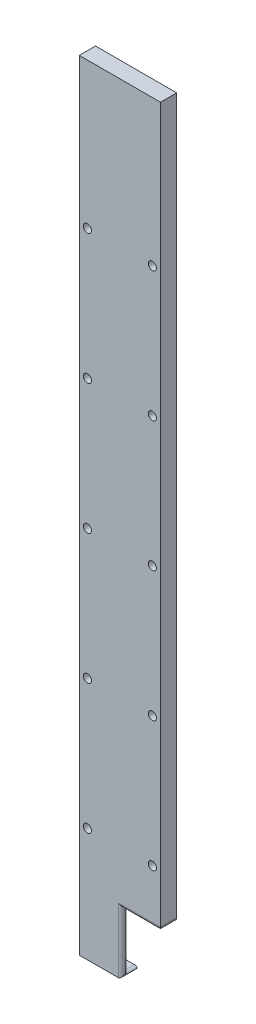
from build123d import *

# Parameters (mm, degrees)
SKETCH2_R           = 1.25
BOSS_EXTRUDE1_DEPTH = 5
CUT_EXTRUDE1_DEPTH  = 3
SKETCH4_W           = 12
SKETCH4_H           = 19
CUT_EXTRUDE2_DEPTH  = 10
FILLET1_R           = 1


with BuildPart() as part:
    # Sketch2 → Boss-Extrude1 (new body)
    with BuildSketch(Plane.XY):
        Polygon((120, 0), (120, -12.5), (145, -12.5), (145, 0), (145, 227.5), (120, 227.5), align=None)
        with Locations((142.5, 22.6)):
            Circle(SKETCH2_R, mode=Mode.SUBTRACT)
        with Locations((142.5, 62.6)):
            Circle(SKETCH2_R, mode=Mode.SUBTRACT)
        with Locations((142.5, 102.6)):
            Circle(SKETCH2_R, mode=Mode.SUBTRACT)
        with Locations((142.5, 142.6)):
            Circle(SKETCH2_R, mode=Mode.SUBTRACT)
        with Locations((142.5, 182.6)):
            Circle(SKETCH2_R, mode=Mode.SUBTRACT)
        with Locations((122.5, 182.6)):
            Circle(SKETCH2_R, mode=Mode.SUBTRACT)
        with Locations((122.5, 142.6)):
            Circle(SKETCH2_R, mode=Mode.SUBTRACT)
        with Locations((122.5, 62.6)):
            Circle(SKETCH2_R, mode=Mode.SUBTRACT)
        with Locations((122.5, 102.6)):
            Circle(SKETCH2_R, mode=Mode.SUBTRACT)
        with Locations((122.5, 22.6)):
            Circle(SKETCH2_R, mode=Mode.SUBTRACT)
    extrude(amount=BOSS_EXTRUDE1_DEPTH)

    # Sketch3 → Cut-Extrude1 (cut)
    with BuildSketch(Plane(origin=(0, 0, 0), x_dir=(-1, 0, 0), z_dir=(0, 0, -1))):
        Polygon((-125, 177.6), (-120, 177.6), (-120, 162.6), (-125, 162.6), (-125, 127.6), (-120, 127.6), (-120, 112.6), (-125, 112.6), (-125, 82.6), (-120, 82.6), (-120, 67.6), (-125, 67.6), (-125, 42.6), (-120, 42.6), (-120, 27.6), (-125, 27.6), (-125, 0), (-125, -11.5), (-145, -11.5), (-145, 6.5), (-140, 6.5), (-140, 205.2), (-125, 205.2), align=None)
    extrude(amount=-CUT_EXTRUDE1_DEPTH, mode=Mode.SUBTRACT)

    # Sketch4 → Cut-Extrude2 (cut)
    with BuildSketch(Plane(origin=(0, 0, 0), x_dir=(-1, 0, 0), z_dir=(0, 0, -1))):
        with Locations((-139, -3)):
            Rectangle(SKETCH4_W, SKETCH4_H)
    extrude(amount=-CUT_EXTRUDE2_DEPTH, mode=Mode.SUBTRACT)

    # Fillet1
    # the kernel refuses this fillet: 1 mm, written as the material it takes off along each edge
    with BuildSketch(Plane(origin=(133, 6.5, 3), x_dir=(0, 0, 1), z_dir=(0, -1, 0))) as fillet1_piece_1:
        with BuildLine():
            CenterArc((FILLET1_R, FILLET1_R), FILLET1_R, 180, 90)
            Line((0, FILLET1_R), (-FILLET1_R * 0.02, FILLET1_R))
            Line((-FILLET1_R * 0.02, FILLET1_R), (-FILLET1_R * 0.02, -FILLET1_R * 0.02))
            Line((-FILLET1_R * 0.02, -FILLET1_R * 0.02), (FILLET1_R, -FILLET1_R * 0.02))
            Line((FILLET1_R, -FILLET1_R * 0.02), (FILLET1_R, 0))
        make_face()
    extrude(amount=18, mode=Mode.SUBTRACT)
    with BuildSketch(Plane(origin=(133, 6.5, 5), x_dir=(0, 0, -1), z_dir=(0, -1, 0))) as fillet1_piece_2:
        with BuildLine():
            CenterArc((FILLET1_R, -FILLET1_R), FILLET1_R, 90, 90)
            Line((0, -FILLET1_R), (-FILLET1_R * 0.02, -FILLET1_R))
            Line((-FILLET1_R * 0.02, -FILLET1_R), (-FILLET1_R * 0.02, FILLET1_R * 0.02))
            Line((-FILLET1_R * 0.02, FILLET1_R * 0.02), (FILLET1_R, FILLET1_R * 0.02))
            Line((FILLET1_R, FILLET1_R * 0.02), (FILLET1_R, 0))
        make_face()
    extrude(amount=19, mode=Mode.SUBTRACT)
    with BuildSketch(Plane(origin=(133, -12.5, 0), x_dir=(0, 1, 0), z_dir=(0, 0, 1)), Plane(origin=(145, 6.5, 5), x_dir=(-1, 0, 0), z_dir=(0, 0, -1))) as fillet1_piece_3:
        with BuildLine():
            CenterArc((FILLET1_R, FILLET1_R), FILLET1_R, 180, 90)
            Line((0, FILLET1_R), (-FILLET1_R * 0.02, FILLET1_R))
            Line((-FILLET1_R * 0.02, FILLET1_R), (-FILLET1_R * 0.02, -FILLET1_R * 0.02))
            Line((-FILLET1_R * 0.02, -FILLET1_R * 0.02), (FILLET1_R, -FILLET1_R * 0.02))
            Line((FILLET1_R, -FILLET1_R * 0.02), (FILLET1_R, 0))
        make_face()
    extrude(amount=5, mode=Mode.SUBTRACT)
    with BuildSketch(Plane(origin=(133, -11.5, 0), x_dir=(0, -1, 0), z_dir=(0, 0, 1)), Plane(origin=(120, 42.6, 0), x_dir=(0, 1, 0), z_dir=(0, 0, 1)), Plane(origin=(120, 82.6, 0), x_dir=(0, 1, 0), z_dir=(0, 0, 1)), Plane(origin=(120, 127.6, 0), x_dir=(0, 1, 0), z_dir=(0, 0, 1)), Plane(origin=(120, 177.6, 0), x_dir=(0, 1, 0), z_dir=(0, 0, 1))) as fillet1_piece_4:
        with BuildLine():
            CenterArc((FILLET1_R, -FILLET1_R), FILLET1_R, 90, 90)
            Line((0, -FILLET1_R), (-FILLET1_R * 0.02, -FILLET1_R))
            Line((-FILLET1_R * 0.02, -FILLET1_R), (-FILLET1_R * 0.02, FILLET1_R * 0.02))
            Line((-FILLET1_R * 0.02, FILLET1_R * 0.02), (FILLET1_R, FILLET1_R * 0.02))
            Line((FILLET1_R, FILLET1_R * 0.02), (FILLET1_R, 0))
        make_face()
    extrude(amount=3, mode=Mode.SUBTRACT)
    with BuildSketch(Plane(origin=(140, 6.5, 0), x_dir=(1, 0, 0), z_dir=(0, 0, 1)), Plane(origin=(120, 27.6, 0), x_dir=(0, -1, 0), z_dir=(0, 0, 1)), Plane(origin=(120, 67.6, 0), x_dir=(0, -1, 0), z_dir=(0, 0, 1)), Plane(origin=(120, 112.6, 0), x_dir=(0, -1, 0), z_dir=(0, 0, 1)), Plane(origin=(120, 162.6, 0), x_dir=(0, -1, 0), z_dir=(0, 0, 1))) as fillet1_piece_5:
        with BuildLine():
            CenterArc((FILLET1_R, FILLET1_R), FILLET1_R, 180, 90)
            Line((0, FILLET1_R), (-FILLET1_R * 0.02, FILLET1_R))
            Line((-FILLET1_R * 0.02, FILLET1_R), (-FILLET1_R * 0.02, -FILLET1_R * 0.02))
            Line((-FILLET1_R * 0.02, -FILLET1_R * 0.02), (FILLET1_R, -FILLET1_R * 0.02))
            Line((FILLET1_R, -FILLET1_R * 0.02), (FILLET1_R, 0))
        make_face()
    extrude(amount=3, mode=Mode.SUBTRACT)
    with BuildSketch(Plane(origin=(140, 6.5, 3), x_dir=(0, 0, 1), z_dir=(-1, 0, 0))) as fillet1_piece_6:
        with BuildLine():
            CenterArc((FILLET1_R, FILLET1_R), FILLET1_R, 180, 90)
            Line((0, FILLET1_R), (-FILLET1_R * 0.02, FILLET1_R))
            Line((-FILLET1_R * 0.02, FILLET1_R), (-FILLET1_R * 0.02, -FILLET1_R * 0.02))
            Line((-FILLET1_R * 0.02, -FILLET1_R * 0.02), (FILLET1_R, -FILLET1_R * 0.02))
            Line((FILLET1_R, -FILLET1_R * 0.02), (FILLET1_R, 0))
        make_face()
    extrude(amount=7, mode=Mode.SUBTRACT)
    with BuildSketch(Plane(origin=(145, 6.5, 5), x_dir=(0, 0, -1), z_dir=(-1, 0, 0))) as fillet1_piece_7:
        with BuildLine():
            CenterArc((FILLET1_R, -FILLET1_R), FILLET1_R, 90, 90)
            Line((0, -FILLET1_R), (-FILLET1_R * 0.02, -FILLET1_R))
            Line((-FILLET1_R * 0.02, -FILLET1_R), (-FILLET1_R * 0.02, FILLET1_R * 0.02))
            Line((-FILLET1_R * 0.02, FILLET1_R * 0.02), (FILLET1_R, FILLET1_R * 0.02))
            Line((FILLET1_R, FILLET1_R * 0.02), (FILLET1_R, 0))
        make_face()
    extrude(amount=12, mode=Mode.SUBTRACT)
    with BuildSketch(Plane(origin=(120, 42.6, 3), x_dir=(0, 0, 1), z_dir=(0, -1, 0)), Plane(origin=(120, 82.6, 3), x_dir=(0, 0, 1), z_dir=(0, -1, 0)), Plane(origin=(120, 127.6, 3), x_dir=(0, 0, 1), z_dir=(0, -1, 0)), Plane(origin=(120, 177.6, 3), x_dir=(0, 0, 1), z_dir=(0, -1, 0))) as fillet1_piece_8:
        with BuildLine():
            CenterArc((FILLET1_R, -FILLET1_R), FILLET1_R, 90, 90)
            Line((0, -FILLET1_R), (-FILLET1_R * 0.02, -FILLET1_R))
            Line((-FILLET1_R * 0.02, -FILLET1_R), (-FILLET1_R * 0.02, FILLET1_R * 0.02))
            Line((-FILLET1_R * 0.02, FILLET1_R * 0.02), (FILLET1_R, FILLET1_R * 0.02))
            Line((FILLET1_R, FILLET1_R * 0.02), (FILLET1_R, 0))
        make_face()
    extrude(amount=15, mode=Mode.SUBTRACT)
    with BuildSketch(Plane(origin=(133, 9, 3), x_dir=(0, 0, 1), z_dir=(0, -1, 0))) as fillet1_piece_9a_section:
        with BuildLine():
            CenterArc((FILLET1_R, FILLET1_R), FILLET1_R, 180, 90)
            Line((0, FILLET1_R), (-FILLET1_R * 0.02, FILLET1_R))
            Line((-FILLET1_R * 0.02, FILLET1_R), (-FILLET1_R * 0.02, -FILLET1_R * 0.02))
            Line((-FILLET1_R * 0.02, -FILLET1_R * 0.02), (FILLET1_R, -FILLET1_R * 0.02))
            Line((FILLET1_R, -FILLET1_R * 0.02), (FILLET1_R, 0))
        make_face()
    fillet1_piece_9a = extrude(amount=20.5, mode=Mode.PRIVATE)
    fillet1_piece_9a = split(fillet1_piece_9a, bisect_by=Plane(origin=(132.773604886, 6.5, 3.226395114), z_dir=(0, 1, 0)), keep=Keep.TOP, mode=Mode.PRIVATE)
    with BuildSketch(Plane(origin=(140, 6.5, 3), x_dir=(0, 0, 1), z_dir=(-1, 0, 0))) as fillet1_piece_9b_section:
        with BuildLine():
            CenterArc((FILLET1_R, FILLET1_R), FILLET1_R, 180, 90)
            Line((0, FILLET1_R), (-FILLET1_R * 0.02, FILLET1_R))
            Line((-FILLET1_R * 0.02, FILLET1_R), (-FILLET1_R * 0.02, -FILLET1_R * 0.02))
            Line((-FILLET1_R * 0.02, -FILLET1_R * 0.02), (FILLET1_R, -FILLET1_R * 0.02))
            Line((FILLET1_R, -FILLET1_R * 0.02), (FILLET1_R, 0))
        make_face()
    fillet1_piece_9b = extrude(amount=9.5, mode=Mode.PRIVATE)
    fillet1_piece_9b = split(fillet1_piece_9b, bisect_by=Plane(origin=(133, 6.726395114, 3.226395114), z_dir=(-1, 0, 0)), keep=Keep.TOP, mode=Mode.PRIVATE)
    fillet1_piece_9 = fillet1_piece_9a & fillet1_piece_9b
    add(fillet1_piece_9, mode=Mode.SUBTRACT)
    with BuildSketch(Plane(origin=(133, -11.5, 0), x_dir=(0, -1, 0), z_dir=(0, 0, 1))) as fillet1_piece_10a_section:
        with BuildLine():
            CenterArc((FILLET1_R, -FILLET1_R), FILLET1_R, 90, 90)
            Line((0, -FILLET1_R), (-FILLET1_R * 0.02, -FILLET1_R))
            Line((-FILLET1_R * 0.02, -FILLET1_R), (-FILLET1_R * 0.02, FILLET1_R * 0.02))
            Line((-FILLET1_R * 0.02, FILLET1_R * 0.02), (FILLET1_R, FILLET1_R * 0.02))
            Line((FILLET1_R, FILLET1_R * 0.02), (FILLET1_R, 0))
        make_face()
    fillet1_piece_10a = extrude(amount=5.5, mode=Mode.PRIVATE)
    fillet1_piece_10a = split(fillet1_piece_10a, bisect_by=Plane(origin=(132.773604886, -11.726395114, 3), z_dir=(0, 0, 1)), keep=Keep.TOP, mode=Mode.PRIVATE)
    with BuildSketch(Plane(origin=(133, 6.5, 3), x_dir=(0, 0, 1), z_dir=(0, -1, 0))) as fillet1_piece_10b_section:
        with BuildLine():
            CenterArc((FILLET1_R, FILLET1_R), FILLET1_R, 180, 90)
            Line((0, FILLET1_R), (-FILLET1_R * 0.02, FILLET1_R))
            Line((-FILLET1_R * 0.02, FILLET1_R), (-FILLET1_R * 0.02, -FILLET1_R * 0.02))
            Line((-FILLET1_R * 0.02, -FILLET1_R * 0.02), (FILLET1_R, -FILLET1_R * 0.02))
            Line((FILLET1_R, -FILLET1_R * 0.02), (FILLET1_R, 0))
        make_face()
    fillet1_piece_10b = extrude(amount=20.5, mode=Mode.PRIVATE)
    fillet1_piece_10b = split(fillet1_piece_10b, bisect_by=Plane(origin=(132.773604886, -11.5, 3.226395114), z_dir=(0, -1, 0)), keep=Keep.TOP, mode=Mode.PRIVATE)
    fillet1_piece_10 = fillet1_piece_10a & fillet1_piece_10b
    add(fillet1_piece_10, mode=Mode.SUBTRACT)
    with BuildSketch(Plane(origin=(133, 9, 5), x_dir=(0, 0, -1), z_dir=(0, -1, 0))) as fillet1_piece_11a_section:
        with BuildLine():
            CenterArc((FILLET1_R, -FILLET1_R), FILLET1_R, 90, 90)
            Line((0, -FILLET1_R), (-FILLET1_R * 0.02, -FILLET1_R))
            Line((-FILLET1_R * 0.02, -FILLET1_R), (-FILLET1_R * 0.02, FILLET1_R * 0.02))
            Line((-FILLET1_R * 0.02, FILLET1_R * 0.02), (FILLET1_R, FILLET1_R * 0.02))
            Line((FILLET1_R, FILLET1_R * 0.02), (FILLET1_R, 0))
        make_face()
    fillet1_piece_11a = extrude(amount=21.5, mode=Mode.PRIVATE)
    fillet1_piece_11a = split(fillet1_piece_11a, bisect_by=Plane(origin=(132.773604886, 6.5, 4.773604886), z_dir=(0, 1, 0)), keep=Keep.TOP, mode=Mode.PRIVATE)
    with BuildSketch(Plane(origin=(145, 6.5, 5), x_dir=(0, 0, -1), z_dir=(-1, 0, 0))) as fillet1_piece_11b_section:
        with BuildLine():
            CenterArc((FILLET1_R, -FILLET1_R), FILLET1_R, 90, 90)
            Line((0, -FILLET1_R), (-FILLET1_R * 0.02, -FILLET1_R))
            Line((-FILLET1_R * 0.02, -FILLET1_R), (-FILLET1_R * 0.02, FILLET1_R * 0.02))
            Line((-FILLET1_R * 0.02, FILLET1_R * 0.02), (FILLET1_R, FILLET1_R * 0.02))
            Line((FILLET1_R, FILLET1_R * 0.02), (FILLET1_R, 0))
        make_face()
    fillet1_piece_11b = extrude(amount=14.5, mode=Mode.PRIVATE)
    fillet1_piece_11b = split(fillet1_piece_11b, bisect_by=Plane(origin=(133, 6.726395114, 4.773604886), z_dir=(-1, 0, 0)), keep=Keep.TOP, mode=Mode.PRIVATE)
    fillet1_piece_11 = fillet1_piece_11a & fillet1_piece_11b
    add(fillet1_piece_11, mode=Mode.SUBTRACT)
    with BuildSketch(Plane(origin=(133, 6.5, 5), x_dir=(0, 0, -1), z_dir=(0, -1, 0))) as fillet1_piece_12a_section:
        with BuildLine():
            CenterArc((FILLET1_R, -FILLET1_R), FILLET1_R, 90, 90)
            Line((0, -FILLET1_R), (-FILLET1_R * 0.02, -FILLET1_R))
            Line((-FILLET1_R * 0.02, -FILLET1_R), (-FILLET1_R * 0.02, FILLET1_R * 0.02))
            Line((-FILLET1_R * 0.02, FILLET1_R * 0.02), (FILLET1_R, FILLET1_R * 0.02))
            Line((FILLET1_R, FILLET1_R * 0.02), (FILLET1_R, 0))
        make_face()
    fillet1_piece_12a = extrude(amount=21.5, mode=Mode.PRIVATE)
    fillet1_piece_12a = split(fillet1_piece_12a, bisect_by=Plane(origin=(132.773604886, -12.5, 4.773604886), z_dir=(0, -1, 0)), keep=Keep.TOP, mode=Mode.PRIVATE)
    with BuildSketch(Plane(origin=(133, -12.5, 0), x_dir=(0, 1, 0), z_dir=(0, 0, 1))) as fillet1_piece_12b_section:
        with BuildLine():
            CenterArc((FILLET1_R, FILLET1_R), FILLET1_R, 180, 90)
            Line((0, FILLET1_R), (-FILLET1_R * 0.02, FILLET1_R))
            Line((-FILLET1_R * 0.02, FILLET1_R), (-FILLET1_R * 0.02, -FILLET1_R * 0.02))
            Line((-FILLET1_R * 0.02, -FILLET1_R * 0.02), (FILLET1_R, -FILLET1_R * 0.02))
            Line((FILLET1_R, -FILLET1_R * 0.02), (FILLET1_R, 0))
        make_face()
    fillet1_piece_12b = extrude(amount=7.5, mode=Mode.PRIVATE)
    fillet1_piece_12b = split(fillet1_piece_12b, bisect_by=Plane(origin=(132.773604886, -12.273604886, 5), z_dir=(0, 0, 1)), keep=Keep.TOP, mode=Mode.PRIVATE)
    fillet1_piece_12 = fillet1_piece_12a & fillet1_piece_12b
    add(fillet1_piece_12, mode=Mode.SUBTRACT)
    with BuildSketch(Plane(origin=(147.5, 6.5, 5), x_dir=(0, 0, -1), z_dir=(-1, 0, 0))) as fillet1_piece_13a_section:
        with BuildLine():
            CenterArc((FILLET1_R, -FILLET1_R), FILLET1_R, 90, 90)
            Line((0, -FILLET1_R), (-FILLET1_R * 0.02, -FILLET1_R))
            Line((-FILLET1_R * 0.02, -FILLET1_R), (-FILLET1_R * 0.02, FILLET1_R * 0.02))
            Line((-FILLET1_R * 0.02, FILLET1_R * 0.02), (FILLET1_R, FILLET1_R * 0.02))
            Line((FILLET1_R, FILLET1_R * 0.02), (FILLET1_R, 0))
        make_face()
    fillet1_piece_13a = extrude(amount=14.5, mode=Mode.PRIVATE)
    fillet1_piece_13a = split(fillet1_piece_13a, bisect_by=Plane(origin=(145, 6.726395114, 4.773604886), z_dir=(1, 0, 0)), keep=Keep.TOP, mode=Mode.PRIVATE)
    with BuildSketch(Plane(origin=(145, 6.5, 7.5), x_dir=(-1, 0, 0), z_dir=(0, 0, -1))) as fillet1_piece_13b_section:
        with BuildLine():
            CenterArc((FILLET1_R, FILLET1_R), FILLET1_R, 180, 90)
            Line((0, FILLET1_R), (-FILLET1_R * 0.02, FILLET1_R))
            Line((-FILLET1_R * 0.02, FILLET1_R), (-FILLET1_R * 0.02, -FILLET1_R * 0.02))
            Line((-FILLET1_R * 0.02, -FILLET1_R * 0.02), (FILLET1_R, -FILLET1_R * 0.02))
            Line((FILLET1_R, -FILLET1_R * 0.02), (FILLET1_R, 0))
        make_face()
    fillet1_piece_13b = extrude(amount=7.5, mode=Mode.PRIVATE)
    fillet1_piece_13b = split(fillet1_piece_13b, bisect_by=Plane(origin=(144.773604886, 6.726395114, 5), z_dir=(0, 0, 1)), keep=Keep.TOP, mode=Mode.PRIVATE)
    fillet1_piece_13 = fillet1_piece_13a & fillet1_piece_13b
    add(fillet1_piece_13, mode=Mode.SUBTRACT)
    with BuildSketch(Plane(origin=(142.5, 6.5, 3), x_dir=(0, 0, 1), z_dir=(-1, 0, 0))) as fillet1_piece_14a_section:
        with BuildLine():
            CenterArc((FILLET1_R, FILLET1_R), FILLET1_R, 180, 90)
            Line((0, FILLET1_R), (-FILLET1_R * 0.02, FILLET1_R))
            Line((-FILLET1_R * 0.02, FILLET1_R), (-FILLET1_R * 0.02, -FILLET1_R * 0.02))
            Line((-FILLET1_R * 0.02, -FILLET1_R * 0.02), (FILLET1_R, -FILLET1_R * 0.02))
            Line((FILLET1_R, -FILLET1_R * 0.02), (FILLET1_R, 0))
        make_face()
    fillet1_piece_14a = extrude(amount=9.5, mode=Mode.PRIVATE)
    fillet1_piece_14a = split(fillet1_piece_14a, bisect_by=Plane(origin=(140, 6.726395114, 3.226395114), z_dir=(1, 0, 0)), keep=Keep.TOP, mode=Mode.PRIVATE)
    with BuildSketch(Plane(origin=(140, 6.5, 0), x_dir=(1, 0, 0), z_dir=(0, 0, 1))) as fillet1_piece_14b_section:
        with BuildLine():
            CenterArc((FILLET1_R, FILLET1_R), FILLET1_R, 180, 90)
            Line((0, FILLET1_R), (-FILLET1_R * 0.02, FILLET1_R))
            Line((-FILLET1_R * 0.02, FILLET1_R), (-FILLET1_R * 0.02, -FILLET1_R * 0.02))
            Line((-FILLET1_R * 0.02, -FILLET1_R * 0.02), (FILLET1_R, -FILLET1_R * 0.02))
            Line((FILLET1_R, -FILLET1_R * 0.02), (FILLET1_R, 0))
        make_face()
    fillet1_piece_14b = extrude(amount=5.5, mode=Mode.PRIVATE)
    fillet1_piece_14b = split(fillet1_piece_14b, bisect_by=Plane(origin=(140.226395114, 6.726395114, 3), z_dir=(0, 0, 1)), keep=Keep.TOP, mode=Mode.PRIVATE)
    fillet1_piece_14 = fillet1_piece_14a & fillet1_piece_14b
    add(fillet1_piece_14, mode=Mode.SUBTRACT)
    with BuildSketch(Plane(origin=(120, 42.6, 0), x_dir=(0, 1, 0), z_dir=(0, 0, 1))) as fillet1_piece_15a_section:
        with BuildLine():
            CenterArc((FILLET1_R, -FILLET1_R), FILLET1_R, 90, 90)
            Line((0, -FILLET1_R), (-FILLET1_R * 0.02, -FILLET1_R))
            Line((-FILLET1_R * 0.02, -FILLET1_R), (-FILLET1_R * 0.02, FILLET1_R * 0.02))
            Line((-FILLET1_R * 0.02, FILLET1_R * 0.02), (FILLET1_R, FILLET1_R * 0.02))
            Line((FILLET1_R, FILLET1_R * 0.02), (FILLET1_R, 0))
        make_face()
    fillet1_piece_15a = extrude(amount=5.5, mode=Mode.PRIVATE)
    fillet1_piece_15a = split(fillet1_piece_15a, bisect_by=Plane(origin=(120.226395114, 42.826395114, 3), z_dir=(0, 0, 1)), keep=Keep.TOP, mode=Mode.PRIVATE)
    with BuildSketch(Plane(origin=(120, 45.1, 3), x_dir=(0, 0, 1), z_dir=(0, -1, 0))) as fillet1_piece_15b_section:
        with BuildLine():
            CenterArc((FILLET1_R, -FILLET1_R), FILLET1_R, 90, 90)
            Line((0, -FILLET1_R), (-FILLET1_R * 0.02, -FILLET1_R))
            Line((-FILLET1_R * 0.02, -FILLET1_R), (-FILLET1_R * 0.02, FILLET1_R * 0.02))
            Line((-FILLET1_R * 0.02, FILLET1_R * 0.02), (FILLET1_R, FILLET1_R * 0.02))
            Line((FILLET1_R, FILLET1_R * 0.02), (FILLET1_R, 0))
        make_face()
    fillet1_piece_15b = extrude(amount=17.5, mode=Mode.PRIVATE)
    fillet1_piece_15b = split(fillet1_piece_15b, bisect_by=Plane(origin=(120.226395114, 42.6, 3.226395114), z_dir=(0, 1, 0)), keep=Keep.TOP, mode=Mode.PRIVATE)
    fillet1_piece_15 = fillet1_piece_15a & fillet1_piece_15b
    add(fillet1_piece_15, mode=Mode.SUBTRACT)
    with BuildSketch(Plane(origin=(120, 42.6, 3), x_dir=(0, 0, 1), z_dir=(0, -1, 0))) as fillet1_piece_16a_section:
        with BuildLine():
            CenterArc((FILLET1_R, -FILLET1_R), FILLET1_R, 90, 90)
            Line((0, -FILLET1_R), (-FILLET1_R * 0.02, -FILLET1_R))
            Line((-FILLET1_R * 0.02, -FILLET1_R), (-FILLET1_R * 0.02, FILLET1_R * 0.02))
            Line((-FILLET1_R * 0.02, FILLET1_R * 0.02), (FILLET1_R, FILLET1_R * 0.02))
            Line((FILLET1_R, FILLET1_R * 0.02), (FILLET1_R, 0))
        make_face()
    fillet1_piece_16a = extrude(amount=17.5, mode=Mode.PRIVATE)
    fillet1_piece_16a = split(fillet1_piece_16a, bisect_by=Plane(origin=(120.226395114, 27.6, 3.226395114), z_dir=(0, -1, 0)), keep=Keep.TOP, mode=Mode.PRIVATE)
    with BuildSketch(Plane(origin=(120, 27.6, 0), x_dir=(0, -1, 0), z_dir=(0, 0, 1))) as fillet1_piece_16b_section:
        with BuildLine():
            CenterArc((FILLET1_R, FILLET1_R), FILLET1_R, 180, 90)
            Line((0, FILLET1_R), (-FILLET1_R * 0.02, FILLET1_R))
            Line((-FILLET1_R * 0.02, FILLET1_R), (-FILLET1_R * 0.02, -FILLET1_R * 0.02))
            Line((-FILLET1_R * 0.02, -FILLET1_R * 0.02), (FILLET1_R, -FILLET1_R * 0.02))
            Line((FILLET1_R, -FILLET1_R * 0.02), (FILLET1_R, 0))
        make_face()
    fillet1_piece_16b = extrude(amount=5.5, mode=Mode.PRIVATE)
    fillet1_piece_16b = split(fillet1_piece_16b, bisect_by=Plane(origin=(120.226395114, 27.373604886, 3), z_dir=(0, 0, 1)), keep=Keep.TOP, mode=Mode.PRIVATE)
    fillet1_piece_16 = fillet1_piece_16a & fillet1_piece_16b
    add(fillet1_piece_16, mode=Mode.SUBTRACT)
    with BuildSketch(Plane(origin=(120, 82.6, 3), x_dir=(0, 0, 1), z_dir=(0, -1, 0))) as fillet1_piece_17a_section:
        with BuildLine():
            CenterArc((FILLET1_R, -FILLET1_R), FILLET1_R, 90, 90)
            Line((0, -FILLET1_R), (-FILLET1_R * 0.0200000000001, -FILLET1_R))
            Line((-FILLET1_R * 0.0200000000001, -FILLET1_R), (-FILLET1_R * 0.02, FILLET1_R * 0.02))
            Line((-FILLET1_R * 0.02, FILLET1_R * 0.02), (FILLET1_R, FILLET1_R * 0.02))
            Line((FILLET1_R, FILLET1_R * 0.02), (FILLET1_R, 0))
        make_face()
    fillet1_piece_17a = extrude(amount=17.5, mode=Mode.PRIVATE)
    fillet1_piece_17a = split(fillet1_piece_17a, bisect_by=Plane(origin=(120.226395114, 67.6, 3.226395114), z_dir=(0, -1, 0)), keep=Keep.TOP, mode=Mode.PRIVATE)
    with BuildSketch(Plane(origin=(120, 67.6, 0), x_dir=(0, -1, 0), z_dir=(0, 0, 1))) as fillet1_piece_17b_section:
        with BuildLine():
            CenterArc((FILLET1_R, FILLET1_R), FILLET1_R, 180, 90)
            Line((0, FILLET1_R), (-FILLET1_R * 0.0200000000001, FILLET1_R))
            Line((-FILLET1_R * 0.0200000000001, FILLET1_R), (-FILLET1_R * 0.02, -FILLET1_R * 0.02))
            Line((-FILLET1_R * 0.02, -FILLET1_R * 0.02), (FILLET1_R, -FILLET1_R * 0.02))
            Line((FILLET1_R, -FILLET1_R * 0.02), (FILLET1_R, 0))
        make_face()
    fillet1_piece_17b = extrude(amount=5.5, mode=Mode.PRIVATE)
    fillet1_piece_17b = split(fillet1_piece_17b, bisect_by=Plane(origin=(120.226395114, 67.373604886, 3), z_dir=(0, 0, 1)), keep=Keep.TOP, mode=Mode.PRIVATE)
    fillet1_piece_17 = fillet1_piece_17a & fillet1_piece_17b
    add(fillet1_piece_17, mode=Mode.SUBTRACT)
    with BuildSketch(Plane(origin=(120, 82.6, 0), x_dir=(0, 1, 0), z_dir=(0, 0, 1))) as fillet1_piece_18a_section:
        with BuildLine():
            CenterArc((FILLET1_R, -FILLET1_R), FILLET1_R, 90, 90)
            Line((0, -FILLET1_R), (-FILLET1_R * 0.0200000000001, -FILLET1_R))
            Line((-FILLET1_R * 0.0200000000001, -FILLET1_R), (-FILLET1_R * 0.02, FILLET1_R * 0.02))
            Line((-FILLET1_R * 0.02, FILLET1_R * 0.02), (FILLET1_R, FILLET1_R * 0.02))
            Line((FILLET1_R, FILLET1_R * 0.02), (FILLET1_R, 0))
        make_face()
    fillet1_piece_18a = extrude(amount=5.5, mode=Mode.PRIVATE)
    fillet1_piece_18a = split(fillet1_piece_18a, bisect_by=Plane(origin=(120.226395114, 82.826395114, 3), z_dir=(0, 0, 1)), keep=Keep.TOP, mode=Mode.PRIVATE)
    with BuildSketch(Plane(origin=(120, 85.1, 3), x_dir=(0, 0, 1), z_dir=(0, -1, 0))) as fillet1_piece_18b_section:
        with BuildLine():
            CenterArc((FILLET1_R, -FILLET1_R), FILLET1_R, 90, 90)
            Line((0, -FILLET1_R), (-FILLET1_R * 0.02, -FILLET1_R))
            Line((-FILLET1_R * 0.02, -FILLET1_R), (-FILLET1_R * 0.02, FILLET1_R * 0.02))
            Line((-FILLET1_R * 0.02, FILLET1_R * 0.02), (FILLET1_R, FILLET1_R * 0.02))
            Line((FILLET1_R, FILLET1_R * 0.02), (FILLET1_R, 0))
        make_face()
    fillet1_piece_18b = extrude(amount=17.5, mode=Mode.PRIVATE)
    fillet1_piece_18b = split(fillet1_piece_18b, bisect_by=Plane(origin=(120.226395114, 82.6, 3.226395114), z_dir=(0, 1, 0)), keep=Keep.TOP, mode=Mode.PRIVATE)
    fillet1_piece_18 = fillet1_piece_18a & fillet1_piece_18b
    add(fillet1_piece_18, mode=Mode.SUBTRACT)
    with BuildSketch(Plane(origin=(120, 127.6, 0), x_dir=(0, 1, 0), z_dir=(0, 0, 1))) as fillet1_piece_19a_section:
        with BuildLine():
            CenterArc((FILLET1_R, -FILLET1_R), FILLET1_R, 90, 90)
            Line((0, -FILLET1_R), (-FILLET1_R * 0.0200000000001, -FILLET1_R))
            Line((-FILLET1_R * 0.0200000000001, -FILLET1_R), (-FILLET1_R * 0.02, FILLET1_R * 0.02))
            Line((-FILLET1_R * 0.02, FILLET1_R * 0.02), (FILLET1_R, FILLET1_R * 0.02))
            Line((FILLET1_R, FILLET1_R * 0.02), (FILLET1_R, 0))
        make_face()
    fillet1_piece_19a = extrude(amount=5.5, mode=Mode.PRIVATE)
    fillet1_piece_19a = split(fillet1_piece_19a, bisect_by=Plane(origin=(120.226395114, 127.826395114, 3), z_dir=(0, 0, 1)), keep=Keep.TOP, mode=Mode.PRIVATE)
    with BuildSketch(Plane(origin=(120, 130.1, 3), x_dir=(0, 0, 1), z_dir=(0, -1, 0))) as fillet1_piece_19b_section:
        with BuildLine():
            CenterArc((FILLET1_R, -FILLET1_R), FILLET1_R, 90, 90)
            Line((0, -FILLET1_R), (-FILLET1_R * 0.02, -FILLET1_R))
            Line((-FILLET1_R * 0.02, -FILLET1_R), (-FILLET1_R * 0.02, FILLET1_R * 0.02))
            Line((-FILLET1_R * 0.02, FILLET1_R * 0.02), (FILLET1_R, FILLET1_R * 0.02))
            Line((FILLET1_R, FILLET1_R * 0.02), (FILLET1_R, 0))
        make_face()
    fillet1_piece_19b = extrude(amount=17.5, mode=Mode.PRIVATE)
    fillet1_piece_19b = split(fillet1_piece_19b, bisect_by=Plane(origin=(120.226395114, 127.6, 3.226395114), z_dir=(0, 1, 0)), keep=Keep.TOP, mode=Mode.PRIVATE)
    fillet1_piece_19 = fillet1_piece_19a & fillet1_piece_19b
    add(fillet1_piece_19, mode=Mode.SUBTRACT)
    with BuildSketch(Plane(origin=(120, 127.6, 3), x_dir=(0, 0, 1), z_dir=(0, -1, 0))) as fillet1_piece_20a_section:
        with BuildLine():
            CenterArc((FILLET1_R, -FILLET1_R), FILLET1_R, 90, 90)
            Line((0, -FILLET1_R), (-FILLET1_R * 0.0200000000001, -FILLET1_R))
            Line((-FILLET1_R * 0.0200000000001, -FILLET1_R), (-FILLET1_R * 0.02, FILLET1_R * 0.02))
            Line((-FILLET1_R * 0.02, FILLET1_R * 0.02), (FILLET1_R, FILLET1_R * 0.02))
            Line((FILLET1_R, FILLET1_R * 0.02), (FILLET1_R, 0))
        make_face()
    fillet1_piece_20a = extrude(amount=17.5, mode=Mode.PRIVATE)
    fillet1_piece_20a = split(fillet1_piece_20a, bisect_by=Plane(origin=(120.226395114, 112.6, 3.226395114), z_dir=(0, -1, 0)), keep=Keep.TOP, mode=Mode.PRIVATE)
    with BuildSketch(Plane(origin=(120, 112.6, 0), x_dir=(0, -1, 0), z_dir=(0, 0, 1))) as fillet1_piece_20b_section:
        with BuildLine():
            CenterArc((FILLET1_R, FILLET1_R), FILLET1_R, 180, 90)
            Line((0, FILLET1_R), (-FILLET1_R * 0.0200000000001, FILLET1_R))
            Line((-FILLET1_R * 0.0200000000001, FILLET1_R), (-FILLET1_R * 0.02, -FILLET1_R * 0.02))
            Line((-FILLET1_R * 0.02, -FILLET1_R * 0.02), (FILLET1_R, -FILLET1_R * 0.02))
            Line((FILLET1_R, -FILLET1_R * 0.02), (FILLET1_R, 0))
        make_face()
    fillet1_piece_20b = extrude(amount=5.5, mode=Mode.PRIVATE)
    fillet1_piece_20b = split(fillet1_piece_20b, bisect_by=Plane(origin=(120.226395114, 112.373604886, 3), z_dir=(0, 0, 1)), keep=Keep.TOP, mode=Mode.PRIVATE)
    fillet1_piece_20 = fillet1_piece_20a & fillet1_piece_20b
    add(fillet1_piece_20, mode=Mode.SUBTRACT)
    with BuildSketch(Plane(origin=(120, 177.6, 0), x_dir=(0, 1, 0), z_dir=(0, 0, 1))) as fillet1_piece_21a_section:
        with BuildLine():
            CenterArc((FILLET1_R, -FILLET1_R), FILLET1_R, 90, 90)
            Line((0, -FILLET1_R), (-FILLET1_R * 0.0200000000002, -FILLET1_R))
            Line((-FILLET1_R * 0.0200000000002, -FILLET1_R), (-FILLET1_R * 0.02, FILLET1_R * 0.02))
            Line((-FILLET1_R * 0.02, FILLET1_R * 0.02), (FILLET1_R, FILLET1_R * 0.02))
            Line((FILLET1_R, FILLET1_R * 0.02), (FILLET1_R, 0))
        make_face()
    fillet1_piece_21a = extrude(amount=5.5, mode=Mode.PRIVATE)
    fillet1_piece_21a = split(fillet1_piece_21a, bisect_by=Plane(origin=(120.226395114, 177.826395114, 3), z_dir=(0, 0, 1)), keep=Keep.TOP, mode=Mode.PRIVATE)
    with BuildSketch(Plane(origin=(120, 180.1, 3), x_dir=(0, 0, 1), z_dir=(0, -1, 0))) as fillet1_piece_21b_section:
        with BuildLine():
            CenterArc((FILLET1_R, -FILLET1_R), FILLET1_R, 90, 90)
            Line((0, -FILLET1_R), (-FILLET1_R * 0.02, -FILLET1_R))
            Line((-FILLET1_R * 0.02, -FILLET1_R), (-FILLET1_R * 0.02, FILLET1_R * 0.02))
            Line((-FILLET1_R * 0.02, FILLET1_R * 0.02), (FILLET1_R, FILLET1_R * 0.02))
            Line((FILLET1_R, FILLET1_R * 0.02), (FILLET1_R, 0))
        make_face()
    fillet1_piece_21b = extrude(amount=17.5, mode=Mode.PRIVATE)
    fillet1_piece_21b = split(fillet1_piece_21b, bisect_by=Plane(origin=(120.226395114, 177.6, 3.226395114), z_dir=(0, 1, 0)), keep=Keep.TOP, mode=Mode.PRIVATE)
    fillet1_piece_21 = fillet1_piece_21a & fillet1_piece_21b
    add(fillet1_piece_21, mode=Mode.SUBTRACT)
    with BuildSketch(Plane(origin=(120, 177.6, 3), x_dir=(0, 0, 1), z_dir=(0, -1, 0))) as fillet1_piece_22a_section:
        with BuildLine():
            CenterArc((FILLET1_R, -FILLET1_R), FILLET1_R, 90, 90)
            Line((0, -FILLET1_R), (-FILLET1_R * 0.0200000000002, -FILLET1_R))
            Line((-FILLET1_R * 0.0200000000002, -FILLET1_R), (-FILLET1_R * 0.02, FILLET1_R * 0.02))
            Line((-FILLET1_R * 0.02, FILLET1_R * 0.02), (FILLET1_R, FILLET1_R * 0.02))
            Line((FILLET1_R, FILLET1_R * 0.02), (FILLET1_R, 0))
        make_face()
    fillet1_piece_22a = extrude(amount=17.5, mode=Mode.PRIVATE)
    fillet1_piece_22a = split(fillet1_piece_22a, bisect_by=Plane(origin=(120.226395114, 162.6, 3.226395114), z_dir=(0, -1, 0)), keep=Keep.TOP, mode=Mode.PRIVATE)
    with BuildSketch(Plane(origin=(120, 162.6, 0), x_dir=(0, -1, 0), z_dir=(0, 0, 1))) as fillet1_piece_22b_section:
        with BuildLine():
            CenterArc((FILLET1_R, FILLET1_R), FILLET1_R, 180, 90)
            Line((0, FILLET1_R), (-FILLET1_R * 0.0200000000002, FILLET1_R))
            Line((-FILLET1_R * 0.0200000000002, FILLET1_R), (-FILLET1_R * 0.02, -FILLET1_R * 0.02))
            Line((-FILLET1_R * 0.02, -FILLET1_R * 0.02), (FILLET1_R, -FILLET1_R * 0.02))
            Line((FILLET1_R, -FILLET1_R * 0.02), (FILLET1_R, 0))
        make_face()
    fillet1_piece_22b = extrude(amount=5.5, mode=Mode.PRIVATE)
    fillet1_piece_22b = split(fillet1_piece_22b, bisect_by=Plane(origin=(120.226395114, 162.373604886, 3), z_dir=(0, 0, 1)), keep=Keep.TOP, mode=Mode.PRIVATE)
    fillet1_piece_22 = fillet1_piece_22a & fillet1_piece_22b
    add(fillet1_piece_22, mode=Mode.SUBTRACT)


solid = part.part
